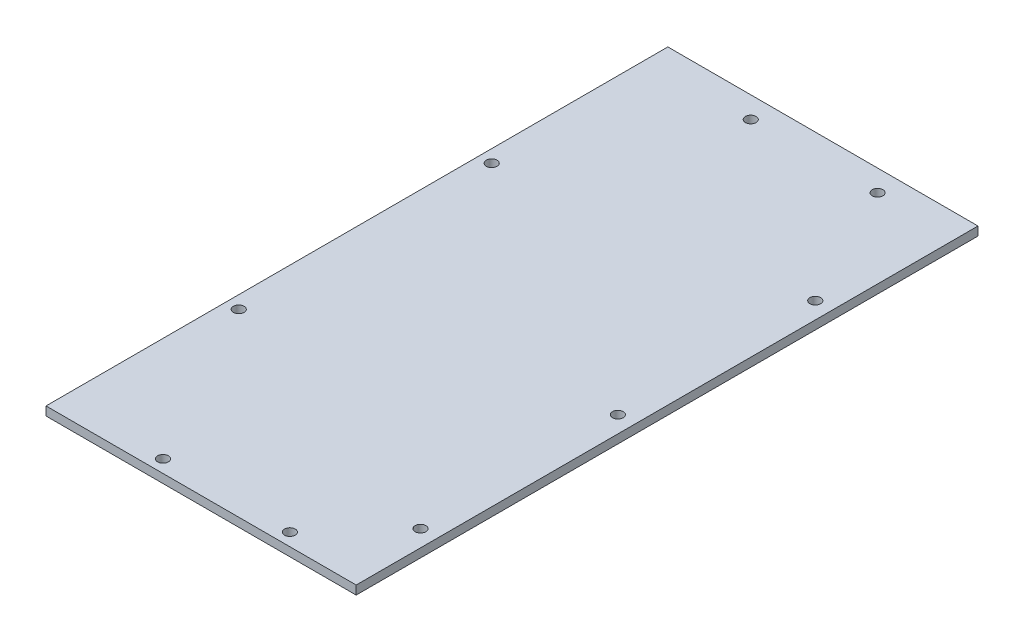
from build123d import *

# Parameters (mm, degrees)
SKETCH1_W             = 110
SKETCH1_H             = 220.5325
BOSS_EXTRUDE1_DEPTH   = 3.1
F_6_CLEARANCE_HOLE1_D = 3.7973
F_6_CLEARANCE_HOLE3_D = 3.7973


with BuildPart() as part:
    # Sketch1 → Boss-Extrude1 (new body)
    with BuildSketch(Plane(origin=(0, 0, 0), x_dir=(1, 0, 0), z_dir=(0, 1, 0))):
        Rectangle(SKETCH1_W, SKETCH1_H)
    extrude(amount=BOSS_EXTRUDE1_DEPTH)

    # #6 Clearance Hole1 (through all)
    with Locations(Plane(origin=(0, 3.1, 0), x_dir=(1, 0, 0), z_dir=(0, 1, 0))):
        with Locations((49.1, 58.45), (49.1, -11.55), (49.1, -81.55), (-50.4997, -46.411275), (-50.4997, 43.307075)):
            Hole(F_6_CLEARANCE_HOLE1_D / 2)

    # #6 Clearance Hole3 (through all)
    with Locations(Plane(origin=(0, 0, 0), x_dir=(-1, 0, 0), z_dir=(0, -1, 0))):
        with Locations((-27.0003, 102.66625), (17.9997, 102.66625), (-27.0003, -105.77045), (17.9997, -105.77045)):
            Hole(F_6_CLEARANCE_HOLE3_D / 2)


solid = part.part
